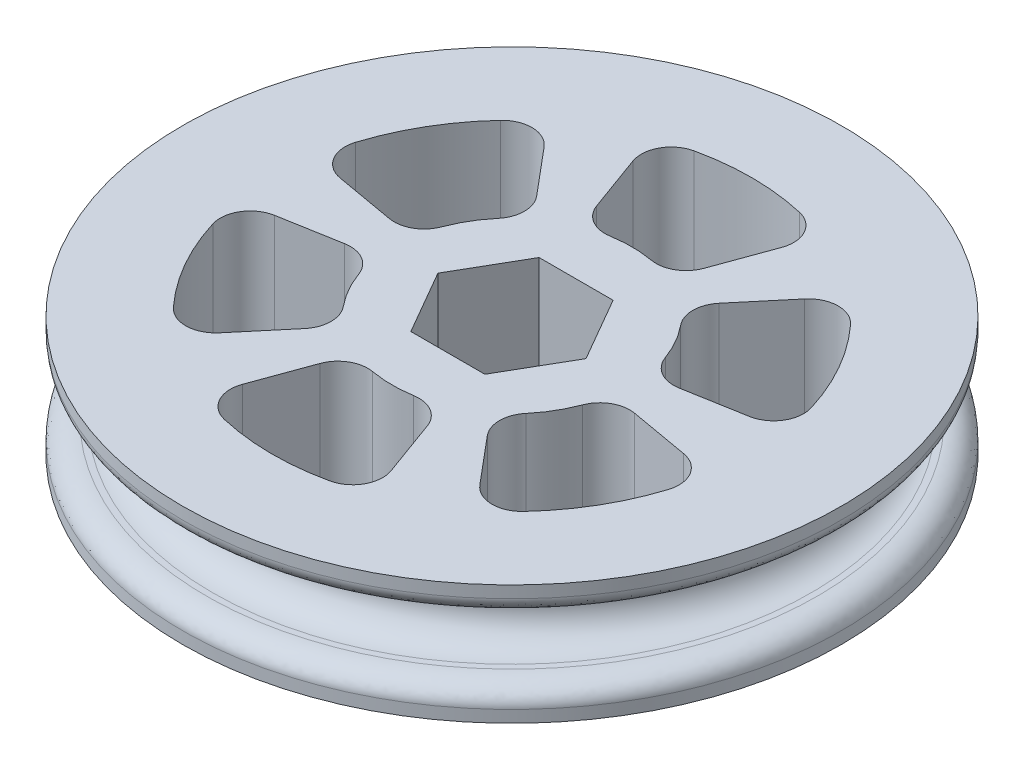
from build123d import *

# Parameters (mm, degrees)
SKETCH1_R           = 34.925
BOSS_EXTRUDE1_DEPTH = 12.7
CUT_EXTRUDE1_DEPTH  = 51.998051433
FILLET_R_SIZE       = 1.905
FILLET_R_SIZE_2     = 2.54


with BuildPart() as part:
    # Sketch1 → Boss-Extrude1 (new body)
    with BuildSketch(Plane(origin=(0, 0, 0), x_dir=(1, 0, 0), z_dir=(0, 1, 0))):
        with Locations(Location((0, 0, 0), (0, 0, 270))):
            Circle(SKETCH1_R)
        Polygon((7.845612808, 0), (3.922806404, 6.7945), (-3.922806404, 6.7945), (-7.845612808, 0), (-3.922806404, -6.7945), (3.922806404, -6.7945), align=None, mode=Mode.SUBTRACT)
    extrude(amount=BOSS_EXTRUDE1_DEPTH)

    # Sketch4 → Cut-Revolve1 (revolve, cut)
    with BuildSketch(Plane(origin=(-6.35, 6.35, 0), x_dir=(0, 1, 0), z_dir=(0, 0, -1)), mode=Mode.PRIVATE) as cut_revolve1_sk:
        with BuildLine():
            Line((3.175, 47.464936897), (3.175, 38.1))
            ThreePointArc((3.175, 38.1), (0, 34.925), (-3.175, 38.1))
            Line((-3.175, 38.1), (-3.175, 47.464936897))
            ThreePointArc((-3.175, 47.464936897), (0, 50.639936897), (3.175, 47.464936897))
        make_face()
    revolve(cut_revolve1_sk.sketch.rotate(Axis((0, 12.7, 0), (0, -1, 0)), 90), axis=Axis((0, 12.7, 0), (0, -1, 0)), mode=Mode.SUBTRACT)

    # Sketch5 → Cut-Extrude1 (cut, through all)
    with BuildSketch(Plane.XZ):
        with BuildLine():
            Line((5.605259426, 14.571101365), (7.803303133, 20.610176817))
            ThreePointArc((7.803303133, 20.610176817), (7.603717557, 23.222626542), (5.508318928, 24.795532311))
            ThreePointArc((5.508318928, 24.795532311), (-0.117173005, 25.399729733), (-5.736851109, 24.743656548))
            ThreePointArc((-5.736851109, 24.743656548), (-7.81069567, 23.164376391), (-8.003268791, 20.564785524))
            Line((-8.003268791, 20.564785524), (-5.808842244, 14.535648138))
            ThreePointArc((-5.808842244, 14.535648138), (-4.406774715, 12.868451088), (-2.260254538, 12.497249674))
            ThreePointArc((-2.260254538, 12.497249674), (-0.082658715, 12.699731003), (2.097388284, 12.525612256))
            ThreePointArc((2.097388284, 12.525612256), (4.221077189, 12.914255634), (5.605259426, 14.571101365))
        make_face()
        with BuildLine():
            Line((15.421573656, 2.431253625), (21.750588267, 3.547229662))
            ThreePointArc((21.750588267, 3.547229662), (23.913243307, 5.026300704), (24.227720346, 7.627422032))
            ThreePointArc((24.227720346, 7.627422032), (21.938224695, 12.801339665), (18.560209599, 17.340087072))
            ThreePointArc((18.560209599, 17.340087072), (16.155590582, 18.346449067), (13.807992292, 17.213426849))
            Line((13.807992292, 17.213426849), (9.683819426, 12.298429019))
            ThreePointArc((9.683819426, 12.298429019), (8.941018192, 10.250604396), (9.692808426, 8.206062686))
            ThreePointArc((9.692808426, 8.206062686), (10.956960312, 6.421450049), (11.896192554, 4.446414593))
            ThreePointArc((11.896192554, 4.446414593), (13.294612044, 2.80156774), (15.421573656, 2.431253625))
        make_face()
        with BuildLine():
            Line((9.81631423, -12.13984774), (13.947285134, -17.062947155))
            ThreePointArc((13.947285134, -17.062947155), (16.30952575, -18.196325838), (18.719401418, -17.168110279))
            ThreePointArc((18.719401418, -17.168110279), (22.0553977, -12.598390067), (24.297060707, -7.403569476))
            ThreePointArc((24.297060707, -7.403569476), (23.966286253, -4.817927324), (21.811261083, -3.351358676))
            Line((21.811261083, -3.351358676), (15.49266167, -2.237219119))
            ThreePointArc((15.49266167, -2.237219119), (13.347792907, -2.617846692), (11.953062965, -4.291186988))
            ThreePointArc((11.953062965, -4.291186988), (11.039619027, -6.278280954), (9.79880427, -8.079197663))
            ThreePointArc((9.79880427, -8.079197663), (9.073534855, -10.112687894), (9.81631423, -12.13984774))
        make_face()
        with BuildLine():
            Line((-5.605259426, -14.571101365), (-7.803303133, -20.610176817))
            ThreePointArc((-7.803303133, -20.610176817), (-7.603717557, -23.222626542), (-5.508318928, -24.795532311))
            ThreePointArc((-5.508318928, -24.795532311), (0.117173005, -25.399729733), (5.736851109, -24.743656548))
            ThreePointArc((5.736851109, -24.743656548), (7.81069567, -23.164376391), (8.003268791, -20.564785524))
            Line((8.003268791, -20.564785524), (5.808842244, -14.535648138))
            ThreePointArc((5.808842244, -14.535648138), (4.406774715, -12.868451088), (2.260254538, -12.497249674))
            ThreePointArc((2.260254538, -12.497249674), (0.082658715, -12.699731003), (-2.097388284, -12.525612256))
            ThreePointArc((-2.097388284, -12.525612256), (-4.221077189, -12.914255634), (-5.605259426, -14.571101365))
        make_face()
        with BuildLine():
            Line((-15.421573656, -2.431253625), (-21.750588267, -3.547229662))
            ThreePointArc((-21.750588267, -3.547229662), (-23.913243307, -5.026300704), (-24.227720346, -7.627422032))
            ThreePointArc((-24.227720346, -7.627422032), (-21.938224695, -12.801339665), (-18.560209599, -17.340087072))
            ThreePointArc((-18.560209599, -17.340087072), (-16.155590582, -18.346449067), (-13.807992292, -17.213426849))
            Line((-13.807992292, -17.213426849), (-9.683819426, -12.298429019))
            ThreePointArc((-9.683819426, -12.298429019), (-8.941018192, -10.250604396), (-9.692808426, -8.206062686))
            ThreePointArc((-9.692808426, -8.206062686), (-10.956960312, -6.421450049), (-11.896192554, -4.446414593))
            ThreePointArc((-11.896192554, -4.446414593), (-13.294612044, -2.80156774), (-15.421573656, -2.431253625))
        make_face()
        with BuildLine():
            Line((-9.81631423, 12.13984774), (-13.947285134, 17.062947155))
            ThreePointArc((-13.947285134, 17.062947155), (-16.30952575, 18.196325838), (-18.719401418, 17.168110279))
            ThreePointArc((-18.719401418, 17.168110279), (-22.0553977, 12.598390067), (-24.297060707, 7.403569476))
            ThreePointArc((-24.297060707, 7.403569476), (-23.966286253, 4.817927324), (-21.811261083, 3.351358676))
            Line((-21.811261083, 3.351358676), (-15.49266167, 2.237219119))
            ThreePointArc((-15.49266167, 2.237219119), (-13.347792907, 2.617846692), (-11.953062965, 4.291186988))
            ThreePointArc((-11.953062965, 4.291186988), (-11.039619027, 6.278280954), (-9.79880427, 8.079197663))
            ThreePointArc((-9.79880427, 8.079197663), (-9.073534855, 10.112687894), (-9.81631423, 12.13984774))
        make_face()
    extrude(amount=-CUT_EXTRUDE1_DEPTH, mode=Mode.SUBTRACT)

    # Fillet r
    # an asymmetric fillet: 2.54, 1.905 mm, written as the material it takes off along each edge
    with BuildSketch(Plane(origin=(0, 3.175, 0), x_dir=(0, 0, 1), z_dir=(1, 0, 0))) as fillet_r_piece_1:
        with BuildLine():
            Bezier((34.925, FILLET_R_SIZE), (34.925, 0), (34.925 - FILLET_R_SIZE_2, 0), weights=[1, 0.707106781, 1])
            Line((34.925 - FILLET_R_SIZE_2, 0), (34.925, 0))
            Line((34.925, 0), (34.925, FILLET_R_SIZE))
        make_face()
    revolve(axis=Axis((0, 3.175, 0), (0, -1, 0)), mode=Mode.SUBTRACT)
    with BuildSketch(Plane(origin=(0, 9.525, 0), x_dir=(0, 0, 1), z_dir=(1, 0, 0))) as fillet_r_piece_2:
        with BuildLine():
            Bezier((34.925 - FILLET_R_SIZE_2, 0), (34.925, 0), (34.925, -FILLET_R_SIZE), weights=[1, 0.707106781, 1])
            Line((34.925, -FILLET_R_SIZE), (34.925, 0))
            Line((34.925, 0), (34.925 - FILLET_R_SIZE_2, 0))
        make_face()
    revolve(axis=Axis((0, 9.525, 0), (0, -1, 0)), mode=Mode.SUBTRACT)


solid = part.part
